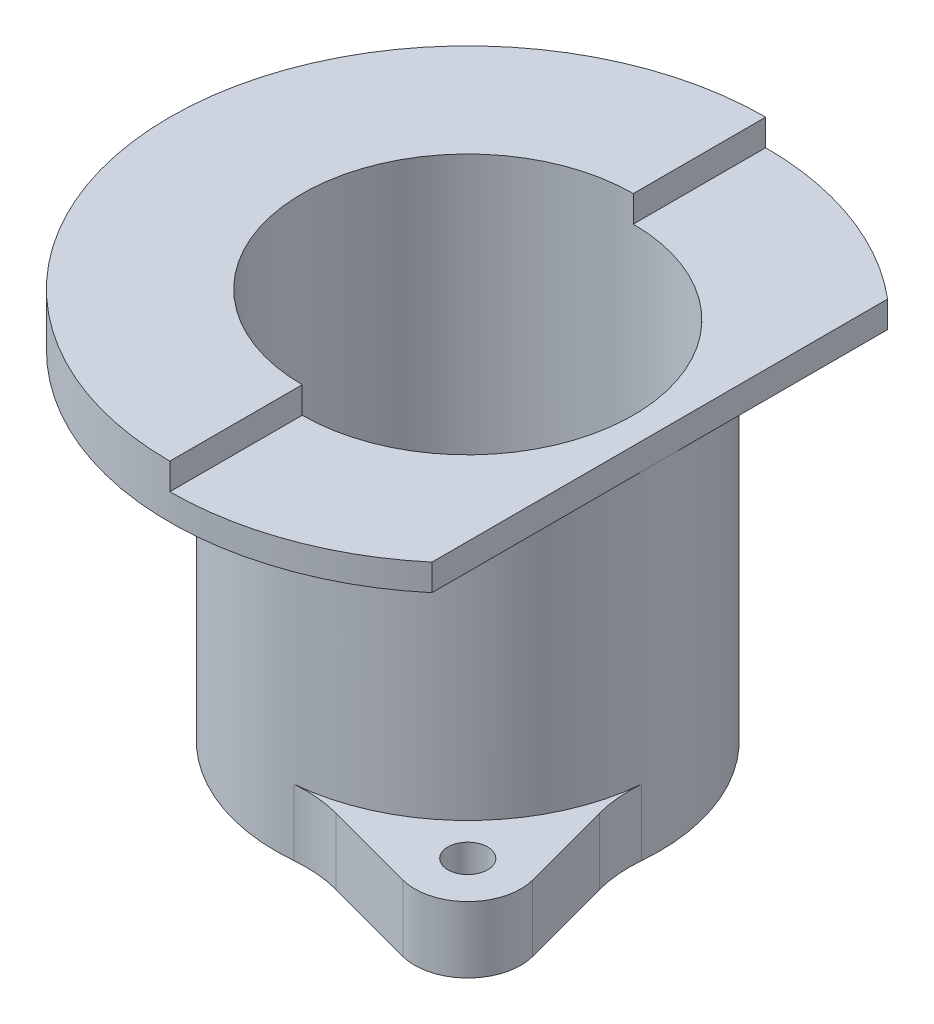
from build123d import *

# Parameters (mm, degrees)
SKETCH_2_R          = 14.5
SKETCH_2_R_2        = 12.5
EXTRUDE_1_DEPTH     = 25.5
SKETCH_3_R          = 22.5
SKETCH_3_R_2        = 12.5
EXTRUDE_2_DEPTH     = 2
EXTRUDE_3_DEPTH     = 2
CUT_EXTRUDE_1_DEPTH = 10
SKETCH_7_R          = 1.500000000000006
SKETCH_7_R_2        = 14.5
SKETCH_7_R_3        = 12.5
SKETCH_7_R_4        = 1.499999999999986
EXTRUDE_4_DEPTH     = 5
FILLET_1_R          = 10


with BuildPart() as part:
    # 草圖2 → 填料-伸長1 (new body)
    with BuildSketch(Plane(origin=(0, 0, 0), x_dir=(1, 0, 0), z_dir=(0, 1, 0))):
        with Locations(Location((0, 0, 0), (0, 0, 270))):
            Circle(SKETCH_2_R)
        with Locations(Location((0, 0, 0), (0, 0, 270))):
            Circle(SKETCH_2_R_2, mode=Mode.SUBTRACT)
    extrude(amount=EXTRUDE_1_DEPTH)

    # 草圖3 → 填料-伸長2 (add)
    with BuildSketch(Plane(origin=(0, 25.5, 0), x_dir=(1, 0, 0), z_dir=(0, 1, 0))):
        with Locations(Location((0, 0, 0), (0, 0, 270))):
            Circle(SKETCH_3_R)
        with Locations(Location((0, 0, 0), (0, 0, 270))):
            Circle(SKETCH_3_R_2, mode=Mode.SUBTRACT)
    extrude(amount=EXTRUDE_2_DEPTH)

    # 草圖4 → 填料-伸長3 (add)
    with BuildSketch(Plane(origin=(0, 27.499999999999996, 0), x_dir=(1, 0, 0), z_dir=(0, 1, 0))):
        with BuildLine():
            Line((0, 22.500000000000004), (4.29e-15, 12.5))
            ThreePointArc((4.29e-15, 12.5), (-12.5, 1.53e-15), (4.29e-15, -12.5))
            Line((4.29e-15, -12.5), (0, -22.500000000000004))
            ThreePointArc((0, -22.500000000000004), (-22.500000000000004, 2.76e-15), (0, 22.500000000000004))
        make_face()
    extrude(amount=EXTRUDE_3_DEPTH)

    # 草圖6 → 除料-伸長1 (cut)
    with BuildSketch(Plane.XZ.offset(-25.5)):
        Polygon((14.499999999999996, 29.395789513712703), (53.33899904059902, 29.395789513712703), (53.33899904059903, -31.21012107711215), (14.500000000000004, -31.21012107711215), align=None)
    extrude(amount=-CUT_EXTRUDE_1_DEPTH, mode=Mode.SUBTRACT)

    # 草圖7 → 填料-伸長4 (add)
    # profile 1 of 3: a face of its own
    with BuildSketch(Plane.XZ):
        with BuildLine():
            ThreePointArc((-16.59162536651419, -11.692645880947747), (-15.556349186104121, -15.556349186104029), (-11.692645880947847, -16.591625366514123))
            Line((-11.692645880947847, -16.591625366514123), (-2.839123359878414, -14.21933115682284))
            ThreePointArc((-2.8391233598784202, -14.219331156822836), (-10.253048327204969, -10.25304832720491), (-14.219331156822854, -2.8391233598783336))
            Line((-14.219331156822806, -2.8391233598783234), (-16.59162536651419, -11.692645880947747))
        make_face()
        with Locations(Location((-12.727922061357921, -12.72792206135785, 0), (0, 0, 270))):
            Circle(SKETCH_7_R, mode=Mode.SUBTRACT)
    # profile 2 of 3: a face of its own
    with BuildSketch(Plane.XZ):
        with Locations(Location((0, 0, 0), (0, 0, 258.708444725))):
            Circle(SKETCH_7_R_2)
        with Locations(Location((0, 0, 0), (0, 0, 90))):
            Circle(SKETCH_7_R_3, mode=Mode.SUBTRACT)
    # profile 3 of 3: a face of its own
    with BuildSketch(Plane.XZ):
        with BuildLine():
            Line((11.692645880947822, 16.591625366514), (2.839123359878405, 14.21933115682271))
            ThreePointArc((2.8391233598784344, 14.219331156822834), (10.253048327205017, 10.25304832720486), (14.219331156822877, 2.8391233598782186))
            Line((14.219331156822797, 2.8391233598782026), (16.591625366514172, 11.692645880947598))
            ThreePointArc((16.591625366514172, 11.692645880947598), (15.556349186104118, 15.556349186103905), (11.692645880947822, 16.591625366514))
        make_face()
        with Locations(Location((12.727922061357914, 12.72792206135772, 0), (0, 0, 270))):
            Circle(SKETCH_7_R_4, mode=Mode.SUBTRACT)
    extrude(amount=-EXTRUDE_4_DEPTH)

    # 圓角1
    # the kernel refuses this fillet: 10 mm, written as the material it adds along each edge
    with BuildSketch(Plane(origin=(-14.21933115682283, 0, -2.8391233598783296), x_dir=(-0.14301440720376446, 0, 0.9897206067027986), z_dir=(0, 1, 0))) as fillet_1_piece_1:
        with BuildLine():
            CenterArc((2.0881667201812895, -9.98565558877935), FILLET_1_R, 93.06924050881132, 20.153074257108685)
            Line((-1.8548317977652202, -0.7958371636160083), (0, 0))
            ThreePointArc((0, 0), (0.7763696780160548, -0.02079939626993994), (1.5527393560321237, -3e-17))
        make_face()
    extrude(amount=5)
    with BuildSketch(Plane(origin=(2.83912335987842, 0, 14.219331156822772), x_dir=(-0.9897206067027934, 0, 0.1430144072038011), z_dir=(0, 1, 0))) as fillet_1_piece_2:
        with BuildLine():
            CenterArc((2.0881667201813614, 9.98565558877934), FILLET_1_R, 246.7776852340785, 20.153074257108983)
            Line((-1.854831797765394, 0.7958371636161028), (0, 0))
            ThreePointArc((0, 0), (0.7763696780159942, 0.02079939626995778), (1.552739356031987, -2e-17))
        make_face()
    extrude(amount=5)
    with BuildSketch(Plane(origin=(14.219331156822836, 0, 2.839123359878211), x_dir=(0.14301440720376882, 0, -0.989720606702798), z_dir=(0, 1, 0))) as fillet_1_piece_3:
        with BuildLine():
            CenterArc((2.088166720181273, -9.985655588779348), FILLET_1_R, 93.06924050881172, 20.1530742571085)
            Line((-1.8548317977652724, -0.795837163616021), (0, 0))
            ThreePointArc((0, 0), (0.7763696780160197, -0.02079939626995059), (1.5527393560320395, 2e-17))
        make_face()
    extrude(amount=5)
    with BuildSketch(Plane(origin=(-2.8391233598784176, 0, -14.21933115682284), x_dir=(0.9897206067028005, 0, -0.1430144072037512), z_dir=(0, 1, 0))) as fillet_1_piece_4:
        with BuildLine():
            CenterArc((2.088166720181194, 9.985655588779359), FILLET_1_R, 246.7776852340814, 20.153074257108187)
            Line((-1.8548317977650892, 0.7958371636159217), (0, 0))
            ThreePointArc((0, 0), (0.7763696780160907, 0.02079939626993076), (1.552739356032181, -2e-17))
        make_face()
    extrude(amount=5)


solid = part.part
